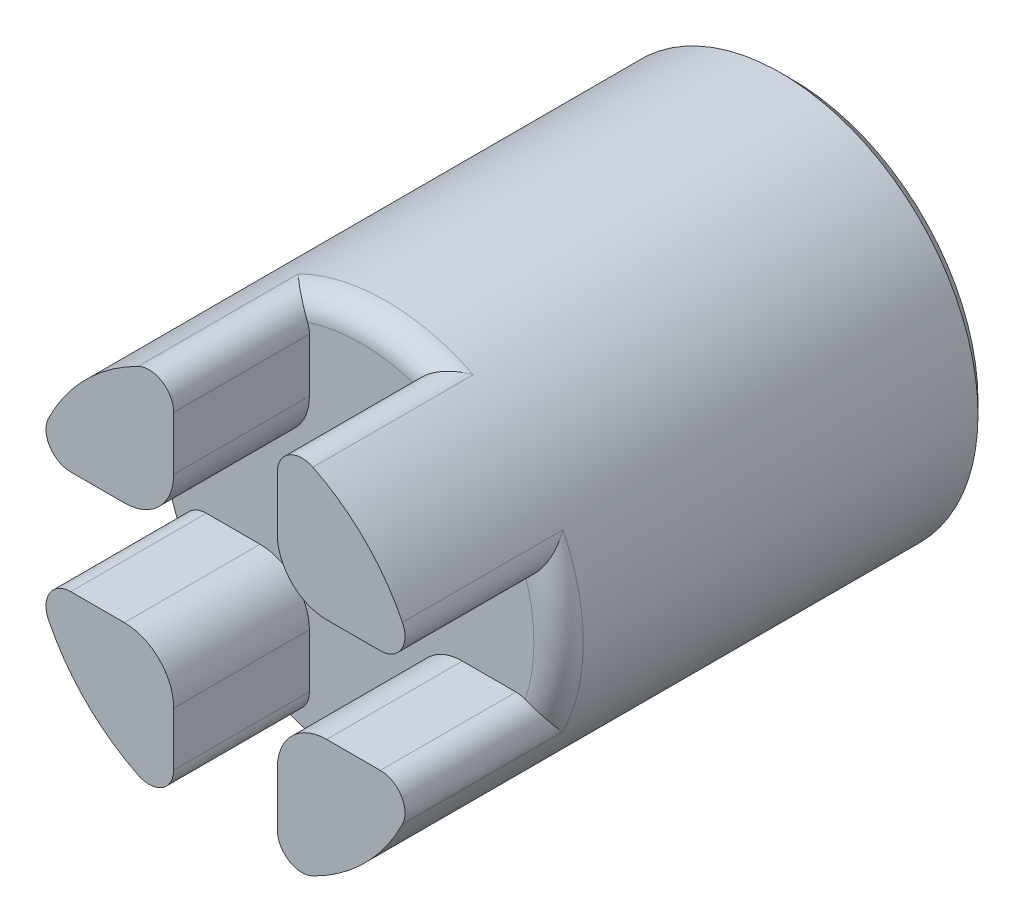
from build123d import *

# Parameters (mm, degrees)
SKETCH1_R           = 8
BOSS_EXTRUDE1_DEPTH = 23
CUT_EXTRUDE1_DEPTH  = 5.5
CHAMFER1_SIZE       = 0.5
FILLET1_R           = 1
SKETCH3_R           = 2.75
CUT_EXTRUDE2_DEPTH  = 15.5
SKETCH5_R           = 3.239790556
SKETCH5_R_2         = 1.3
BOSS_EXTRUDE2_DEPTH = 4


with BuildPart() as part:
    # Sketch1 → Boss-Extrude1 (new body)
    with BuildSketch(Plane.XY):
        Circle(SKETCH1_R)
        with BuildLine():
            Line((-1.3, 1.64924225), (-1.3, -1.64924225))
            ThreePointArc((-1.3, -1.64924225), (2.1, 0), (-1.3, 1.64924225))
        make_face(mode=Mode.SUBTRACT)
    extrude(amount=BOSS_EXTRUDE1_DEPTH)

    # Sketch2 → Cut-Extrude1 (cut)
    with BuildSketch(Plane.XY.offset(23)):
        with BuildLine():
            Line((4.1, 2.1), (9.874781321, 2.1))
            Line((9.874781321, 2.1), (9.874781321, -2.1))
            Line((9.874781321, -2.1), (4.1, -2.1))
            ThreePointArc((4.1, -2.1), (2.685786438, -2.685786438), (2.1, -4.1))
            Line((2.1, -4.1), (2.1, -8.269913673))
            Line((2.1, -8.269913673), (-2.1, -8.269913673))
            Line((-2.1, -8.269913673), (-2.1, -4.1))
            ThreePointArc((-2.1, -4.1), (-2.685786438, -2.685786438), (-4.1, -2.1))
            Line((-4.1, -2.1), (-9.874781321, -2.1))
            Line((-9.874781321, -2.1), (-9.874781321, 2.1))
            Line((-9.874781321, 2.1), (-4.1, 2.1))
            ThreePointArc((-4.1, 2.1), (-2.685786438, 2.685786438), (-2.1, 4.1))
            Line((-2.1, 4.1), (-2.1, 8.269913673))
            Line((-2.1, 8.269913673), (2.1, 8.269913673))
            Line((2.1, 8.269913673), (2.1, 4.1))
            ThreePointArc((2.1, 4.1), (2.685786438, 2.685786438), (4.1, 2.1))
        make_face()
    extrude(amount=-CUT_EXTRUDE1_DEPTH, mode=Mode.SUBTRACT)

    # Chamfer1
    chamfer1_edges = [part.edges().sort_by_distance(p)[0] for p in [
        (-8, 0, 0),
    ]]
    chamfer(chamfer1_edges, length=CHAMFER1_SIZE)

    # Fillet1
    # the kernel refuses this fillet: 1 mm, written as the material it takes off along each edge
    with BuildSketch(Plane(origin=(-7.719455939, 2.1, 26.857409903), x_dir=(0.35433001139154063, 0.9351204430592194, 0), z_dir=(0, 0, -1)), Plane(origin=(-2.1, -7.719455939, 26.857409903), x_dir=(-0.9351204430592192, 0.354330011391541, 0), z_dir=(0, 0, -1)), Plane(origin=(7.719455939, -2.1, 26.857409903), x_dir=(-0.354330011391541, -0.9351204430592192, 0), z_dir=(0, 0, -1)), Plane(origin=(2.1, 7.719455939, 26.857409903), x_dir=(0.935120443059219, -0.3543300113915411, 0), z_dir=(0, 0, -1))) as fillet1_piece_1:
        with BuildLine():
            CenterArc((1.446528713, 0.99533926), FILLET1_R, 159.247612079, 116.286320683)
            Line((0.51140827, 1.349669272), (0, 0))
            ThreePointArc((0, 0), (0.771481981, -0.037285918), (1.542963961, 0))
        make_face()
    extrude(amount=9.357409903, mode=Mode.SUBTRACT)
    with BuildSketch(Plane(origin=(-7.719455939, -2.1, 26.857409903), x_dir=(0.35433001139154124, -0.9351204430592192, 0), z_dir=(0, 0, -1)), Plane(origin=(2.1, -7.719455939, 26.857409903), x_dir=(0.935120443059219, 0.3543300113915412, 0), z_dir=(0, 0, -1)), Plane(origin=(7.719455939, 2.1, 26.857409903), x_dir=(-0.3543300113915409, 0.9351204430592193, 0), z_dir=(0, 0, -1)), Plane(origin=(-2.1, 7.719455939, 26.857409903), x_dir=(-0.935120443059219, -0.3543300113915412, 0), z_dir=(0, 0, -1))) as fillet1_piece_2:
        with BuildLine():
            CenterArc((1.446528713, -0.99533926), FILLET1_R, 84.466067237, 116.286320683)
            Line((0.51140827, -1.349669272), (0, 0))
            ThreePointArc((0, 0), (0.771481981, 0.037285918), (1.542963961, 0))
        make_face()
    extrude(amount=9.357409903, mode=Mode.SUBTRACT)
    with BuildSketch(Plane(origin=(0, 0, 17.5), x_dir=(1, 0, 0), z_dir=(0, 1, 0))) as fillet1_piece_3_section:
        with BuildLine():
            CenterArc((8 - FILLET1_R, FILLET1_R), FILLET1_R, 270, 90)
            Line((8 - FILLET1_R, 0), (8, 0))
            Line((8, 0), (8, FILLET1_R))
        make_face()
    fillet1_piece_3 = revolve(axis=Axis((0, 0, 17.5), (0, 0, -1)), revolution_arc=33.123591855, mode=Mode.PRIVATE)
    fillet1_piece_3 = split(fillet1_piece_3, bisect_by=Plane(origin=(7.676771465, -2.1, 17.273698774), z_dir=(0, 1, 0)), keep=Keep.TOP, mode=Mode.PRIVATE)
    add(fillet1_piece_3, mode=Mode.SUBTRACT)
    with BuildSketch(Plane(origin=(0, 0, 17.5), x_dir=(-0.5464558660226709, 0.8374879022943631, 0), z_dir=(-0.8374879022943631, -0.5464558660226709, 0))) as fillet1_piece_4_section:
        with BuildLine():
            CenterArc((8 - FILLET1_R, FILLET1_R), FILLET1_R, 270, 90)
            Line((8 - FILLET1_R, 0), (8, 0))
            Line((8, 0), (8, FILLET1_R))
        make_face()
    fillet1_piece_4 = revolve(axis=Axis((0, 0, 17.5), (0, 0, -1)), revolution_arc=66.248417342, mode=Mode.PRIVATE)
    fillet1_piece_4 = split(fillet1_piece_4, bisect_by=Plane(origin=(2.1, 7.676771683, 17.273698772), z_dir=(-1, 0, 0)), keep=Keep.TOP, mode=Mode.PRIVATE)
    fillet1_piece_4 = split(fillet1_piece_4, bisect_by=Plane(origin=(-2.1, 7.676771683, 17.273698772), z_dir=(1, 0, 0)), keep=Keep.TOP, mode=Mode.PRIVATE)
    add(fillet1_piece_4, mode=Mode.SUBTRACT)
    with BuildSketch(Plane(origin=(0, 0, 17.5), x_dir=(0.8374937851055057, 0.5464468500317786, 0), z_dir=(-0.5464468500317786, 0.8374937851055057, 0))) as fillet1_piece_5_section:
        with BuildLine():
            CenterArc((8 - FILLET1_R, FILLET1_R), FILLET1_R, 270, 90)
            Line((8 - FILLET1_R, 0), (8, 0))
            Line((8, 0), (8, FILLET1_R))
        make_face()
    fillet1_piece_5 = revolve(axis=Axis((0, 0, 17.5), (0, 0, -1)), revolution_arc=33.123591855, mode=Mode.PRIVATE)
    fillet1_piece_5 = split(fillet1_piece_5, bisect_by=Plane(origin=(7.676771942, 2.1, 17.273698679), z_dir=(0, -1, 0)), keep=Keep.TOP, mode=Mode.PRIVATE)
    add(fillet1_piece_5, mode=Mode.SUBTRACT)
    with BuildSketch(Plane(origin=(0, 0, 17.5), x_dir=(1, 0, 0), z_dir=(0, 1, 0))) as fillet1_piece_6a_section:
        with BuildLine():
            CenterArc((8 - FILLET1_R, FILLET1_R), FILLET1_R, 270, 90)
            Line((8 - FILLET1_R, 0), (8, 0))
            Line((8, 0), (8, FILLET1_R))
        make_face()
    fillet1_piece_6a = revolve(axis=Axis((0, 0, 17.5), (0, 0, -1)), revolution_arc=33.123591855, mode=Mode.PRIVATE)
    fillet1_piece_6a = split(fillet1_piece_6a, bisect_by=Plane(origin=(7.062995789, -2.1, 17.266816247), z_dir=(0, -1, 0)), keep=Keep.TOP, mode=Mode.PRIVATE)
    with BuildSketch(Plane(origin=(7.719455939, -2.1, 26.857409903), x_dir=(-0.354330011391541, -0.9351204430592192, 0), z_dir=(0, 0, -1))) as fillet1_piece_6b_section:
        with BuildLine():
            CenterArc((1.446528713, 0.99533926), FILLET1_R, 159.247612079, 116.286320683)
            Line((0.51140827, 1.349669272), (0, 0))
            ThreePointArc((0, 0), (0.771481981, -0.037285918), (1.542963961, 0))
        make_face()
    fillet1_piece_6b = extrude(amount=13.214819805, mode=Mode.PRIVATE)
    fillet1_piece_6b = split(fillet1_piece_6b, bisect_by=Plane(origin=(7.268798231, -2.449324776, 17.5), z_dir=(0, 0, -1)), keep=Keep.TOP, mode=Mode.PRIVATE)
    fillet1_piece_6 = fillet1_piece_6a & fillet1_piece_6b
    add(fillet1_piece_6, mode=Mode.SUBTRACT)
    with BuildSketch(Plane(origin=(0, 0, 17.5), x_dir=(0.8374937851055057, 0.5464468500317786, 0), z_dir=(-0.5464468500317786, 0.8374937851055057, 0))) as fillet1_piece_7a_section:
        with BuildLine():
            CenterArc((8 - FILLET1_R, FILLET1_R), FILLET1_R, 270, 90)
            Line((8 - FILLET1_R, 0), (8, 0))
            Line((8, 0), (8, FILLET1_R))
        make_face()
    fillet1_piece_7a = revolve(axis=Axis((0, 0, 17.5), (0, 0, -1)), revolution_arc=33.123591855, mode=Mode.PRIVATE)
    fillet1_piece_7a = split(fillet1_piece_7a, bisect_by=Plane(origin=(7.062995574, 2.1, 17.266816271), z_dir=(0, 1, 0)), keep=Keep.TOP, mode=Mode.PRIVATE)
    with BuildSketch(Plane(origin=(7.719455939, 2.1, 26.857409903), x_dir=(-0.3543300113915409, 0.9351204430592193, 0), z_dir=(0, 0, -1))) as fillet1_piece_7b_section:
        with BuildLine():
            CenterArc((1.446528713, -0.99533926), FILLET1_R, 84.466067237, 116.286320683)
            Line((0.51140827, -1.349669272), (0, 0))
            ThreePointArc((0, 0), (0.771481981, 0.037285918), (1.542963961, 0))
        make_face()
    fillet1_piece_7b = extrude(amount=13.214819805, mode=Mode.PRIVATE)
    fillet1_piece_7b = split(fillet1_piece_7b, bisect_by=Plane(origin=(7.268798231, 2.449324776, 17.5), z_dir=(0, 0, -1)), keep=Keep.TOP, mode=Mode.PRIVATE)
    fillet1_piece_7 = fillet1_piece_7a & fillet1_piece_7b
    add(fillet1_piece_7, mode=Mode.SUBTRACT)
    with BuildSketch(Plane(origin=(2.1, 7.719455939, 26.857409903), x_dir=(0.935120443059219, -0.3543300113915411, 0), z_dir=(0, 0, -1))) as fillet1_piece_8a_section:
        with BuildLine():
            CenterArc((1.446528713, 0.99533926), FILLET1_R, 159.247612079, 116.286320683)
            Line((0.51140827, 1.349669272), (0, 0))
            ThreePointArc((0, 0), (0.771481981, -0.037285918), (1.542963961, 0))
        make_face()
    fillet1_piece_8a = extrude(amount=13.214819805, mode=Mode.PRIVATE)
    fillet1_piece_8a = split(fillet1_piece_8a, bisect_by=Plane(origin=(2.449324776, 7.268798231, 17.5), z_dir=(0, 0, -1)), keep=Keep.TOP, mode=Mode.PRIVATE)
    with BuildSketch(Plane(origin=(0, 0, 17.5), x_dir=(-0.5464558660226709, 0.8374879022943631, 0), z_dir=(-0.8374879022943631, -0.5464558660226709, 0))) as fillet1_piece_8b_section:
        with BuildLine():
            CenterArc((8 - FILLET1_R, FILLET1_R), FILLET1_R, 270, 90)
            Line((8 - FILLET1_R, 0), (8, 0))
            Line((8, 0), (8, FILLET1_R))
        make_face()
    fillet1_piece_8b = revolve(axis=Axis((0, 0, 17.5), (0, 0, -1)), revolution_arc=66.248417342, mode=Mode.PRIVATE)
    fillet1_piece_8b = split(fillet1_piece_8b, bisect_by=Plane(origin=(2.1, 7.062976431, 17.266816363), z_dir=(1, 0, 0)), keep=Keep.TOP, mode=Mode.PRIVATE)
    fillet1_piece_8 = fillet1_piece_8a & fillet1_piece_8b
    add(fillet1_piece_8, mode=Mode.SUBTRACT)
    with BuildSketch(Plane(origin=(0, 0, 17.5), x_dir=(-0.5464558660226709, 0.8374879022943631, 0), z_dir=(-0.8374879022943631, -0.5464558660226709, 0))) as fillet1_piece_9a_section:
        with BuildLine():
            CenterArc((8 - FILLET1_R, FILLET1_R), FILLET1_R, 270, 90)
            Line((8 - FILLET1_R, 0), (8, 0))
            Line((8, 0), (8, FILLET1_R))
        make_face()
    fillet1_piece_9a = revolve(axis=Axis((0, 0, 17.5), (0, 0, -1)), revolution_arc=66.248417342, mode=Mode.PRIVATE)
    fillet1_piece_9a = split(fillet1_piece_9a, bisect_by=Plane(origin=(-2.1, 7.062976216, 17.266816386), z_dir=(-1, 0, 0)), keep=Keep.TOP, mode=Mode.PRIVATE)
    with BuildSketch(Plane(origin=(-2.1, 7.719455939, 26.857409903), x_dir=(-0.935120443059219, -0.3543300113915412, 0), z_dir=(0, 0, -1))) as fillet1_piece_9b_section:
        with BuildLine():
            CenterArc((1.446528713, -0.99533926), FILLET1_R, 84.466067237, 116.286320683)
            Line((0.51140827, -1.349669272), (0, 0))
            ThreePointArc((0, 0), (0.771481981, 0.037285918), (1.542963961, 0))
        make_face()
    fillet1_piece_9b = extrude(amount=13.214819805, mode=Mode.PRIVATE)
    fillet1_piece_9b = split(fillet1_piece_9b, bisect_by=Plane(origin=(-2.449324776, 7.268798231, 17.5), z_dir=(0, 0, -1)), keep=Keep.TOP, mode=Mode.PRIVATE)
    fillet1_piece_9 = fillet1_piece_9a & fillet1_piece_9b
    add(fillet1_piece_9, mode=Mode.SUBTRACT)

    # Sketch3 → Cut-Extrude2 (cut)
    with BuildSketch(Plane(origin=(-1.3, 0, 0), x_dir=(0, 0, -1), z_dir=(1, 0, 0))):
        with Locations(Location((-7.343789521, 0, 0), (0, 0, 36.850165711))):
            Circle(SKETCH3_R)
    extrude(amount=-CUT_EXTRUDE2_DEPTH, mode=Mode.SUBTRACT)

    # Sketch5 → Boss-Extrude2 (add)
    with BuildSketch(Plane(origin=(-1.3, 0, 0), x_dir=(0, 0, -1), z_dir=(1, 0, 0))):
        with Locations((-7.343789521, 0)):
            Circle(SKETCH5_R)
        with Locations((-7.343789521, 0)):
            Circle(SKETCH5_R_2, mode=Mode.SUBTRACT)
    extrude(amount=-BOSS_EXTRUDE2_DEPTH)


solid = part.part
